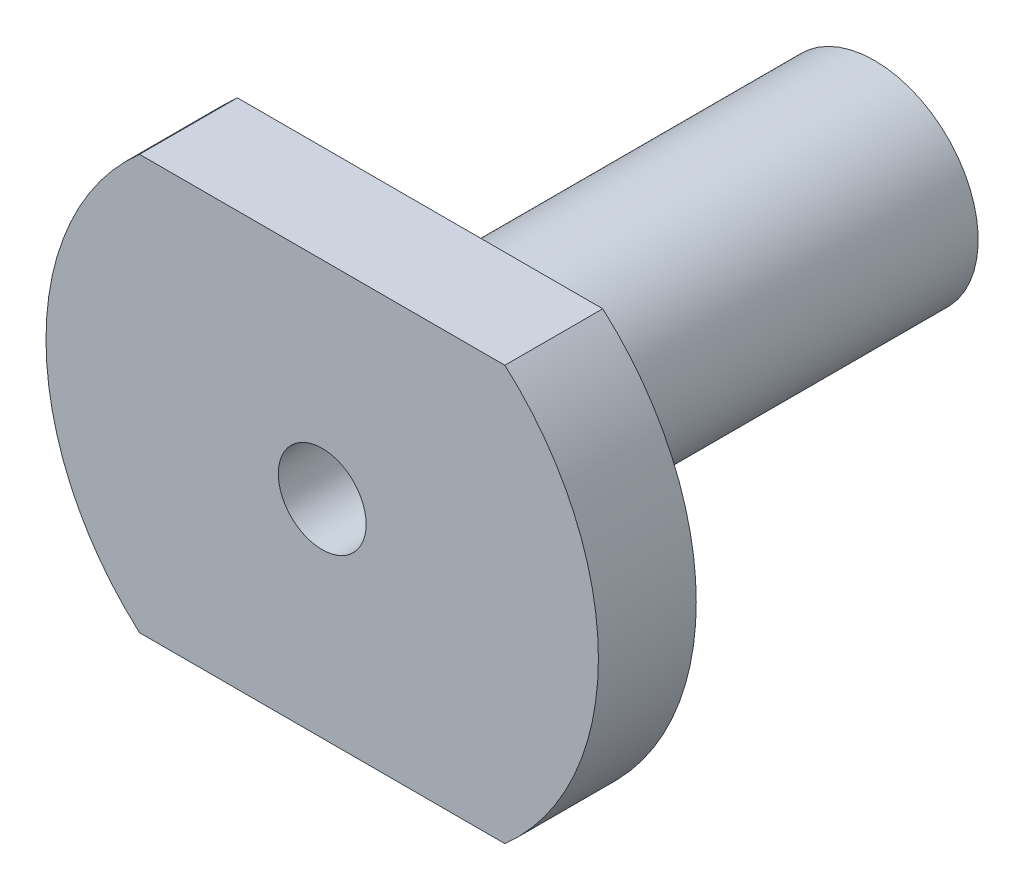
from build123d import *

# Parameters (mm, degrees)
TAP_DRILL_FOR_10_32_TAP1_D = 4.0386
SKETCH5_W                  = 25.4
SKETCH5_H                  = 3.175
CUT_EXTRUDE1_DEPTH         = 32.108519733


with BuildPart() as part:
    # Sketch1 → Revolve1 (revolve)
    with BuildSketch(Plane(origin=(0, 0, 0), x_dir=(0, 0, -1), z_dir=(1, 0, 0))):
        Polygon((0, 0), (0, 12.7), (4.5, 12.7), (4.5, 6.0325), (5.77, 6.0325), (5.77, 4.7625), (25.4, 4.7625), (25.4, 0), align=None)
    revolve(axis=Axis((0, 0, 0), (0, 0, -1)))

    # Tap Drill for #10-32 Tap1 (through all)
    with Locations(Plane.XY):
        with Locations((0, 0)):
            Hole(TAP_DRILL_FOR_10_32_TAP1_D / 2)

    # Sketch5 → Cut-Extrude1 (cut, through all)
    with BuildSketch(Plane.XY):
        with Locations((0, 11.1125)):
            Rectangle(SKETCH5_W, SKETCH5_H)
        with Locations((0, -11.1125)):
            Rectangle(SKETCH5_W, SKETCH5_H)
    extrude(amount=-CUT_EXTRUDE1_DEPTH, mode=Mode.SUBTRACT)


solid = part.part
